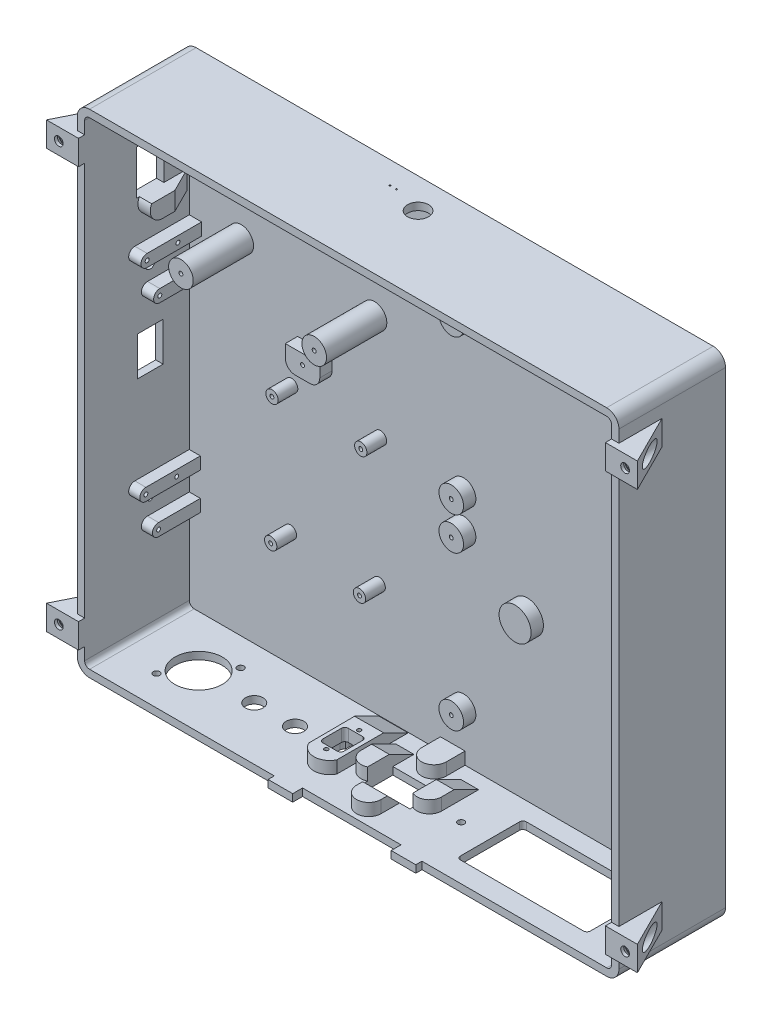
from build123d import *

# Parameters (mm, degrees)
SKETCH2_W                                      = 279.4
SKETCH2_H                                      = 254
BOSS_EXTRUDE1_DEPTH                            = 1
FILLET2_R                                      = 6.35
BOSS_EXTRUDE3_START                            = 57.15
BOSS_EXTRUDE3_DEPTH                            = 57.15
SKETCH7_W                                      = 50.8
SKETCH7_H                                      = 5.08
ROMEX_ENTRY_SLOT_DEPTH                         = 57.15
BOSS_EXTRUDE4_DEPTH                            = 12.7
SKETCH9_R                                      = 3.81
CUT_EXTRUDE2_DEPTH                             = 35.306
MIRROR3_COPY_1_DEPTH                           = 12.7
MIRROR3_COPY_2_SKETCH_R                        = 3.81
MIRROR3_COPY_2_DEPTH                           = 35.306
MIRROR4_COPY_1_DEPTH                           = 12.7
MIRROR4_COPY_2_SKETCH_R                        = 3.81
MIRROR4_COPY_2_DEPTH                           = 35.306
MIRROR4_COPY_4_DEPTH                           = 12.7
MIRROR4_COPY_5_SKETCH_R                        = 3.81
MIRROR4_COPY_5_DEPTH                           = 35.306
MIRROR4_COPY_7_DEPTH                           = 12.7
MIRROR4_COPY_8_SKETCH_R                        = 3.81
MIRROR4_COPY_8_DEPTH                           = 35.306
SKETCH15_W                                     = 12.7
SKETCH15_H                                     = 228.6
CUT_EXTRUDE4_DEPTH                             = 30.226
CUT_EXTRUDE8_REACH                             = 325.779
SKETCH24_R                                     = 2.5019
SKETCH24_R_2                                   = 1.318988248
SKETCH24_W                                     = 13.208
SKETCH24_H                                     = 20.066
SKETCH24_W_2                                   = 14.0462
SKETCH24_H_2                                   = 22.86
CUT_EXTRUDE10_REACH                            = 325.779
SKETCH30_R                                     = 1.27
RIGHT_SIDE_FRONT_STANDOFFS_DEPTH               = 6.35
RIGHT_SIDE_REAR_STANDOFFS_DEPTH                = 5.715
F_3_0_213_DIAMETER_HOLE1_D                     = 2.032
F_3_0_213_DIAMETER_HOLE1_DEPTH                 = 6.35
F_3_0_213_DIAMETER_HOLE1_TIP                   = 0.610474389
F_3_0_213_DIAMETER_HOLE2_D                     = 2.032
F_3_0_213_DIAMETER_HOLE2_DEPTH                 = 6.35
F_3_0_213_DIAMETER_HOLE2_TIP                   = 0.610474389
SKETCH39_R                                     = 8.255
SKETCH39_R_2                                   = 6.35
BOSS_EXTRUDE11_DEPTH                           = 6.35
STANDOFF_HOLES_D                               = 2.032
STANDOFF_HOLES_DEPTH                           = 6.35
STANDOFF_HOLES_TIP                             = 0.610474389
SKETCH49_R                                     = 3.175
MOTHERBOARD_STANDOFFS_DEPTH                    = 10.16
MOTHERBOARD_SCREW_HOLES_D                      = 2.032
MOTHERBOARD_SCREW_HOLES_DEPTH                  = 6.35
MOTHERBOARD_SCREW_HOLES_TIP                    = 0.610474389
BOSS_EXTRUDE13_DEPTH                           = 6.35
SKETCH58_R                                     = 4.572
SKETCH58_R_2                                   = 12.2428
SKETCH58_R_3                                   = 1.7
SKETCH58_R_4                                   = 1.651
CUT_EXTRUDE13_DEPTH                            = 3.81
CUT_EXTRUDE14_REACH                            = 303.866
SKETCH59_R                                     = 5.4356
SKETCH59_R_2                                   = 0.381
SKETCH60_R                                     = 6.35
BOSS_EXTRUDE15_DEPTH                           = 31.115
F_3_0_213_DIAMETER_HOLE6_D                     = 2.032
F_3_0_213_DIAMETER_HOLE6_DEPTH                 = 6.35
F_3_0_213_DIAMETER_HOLE6_TIP                   = 0.610474389
VENT_CUT_DEPTH                                 = 207.727314354
VENT_CUT_DEPTH_BACK                            = 3.175
SKETCH63_W                                     = 3.81
SKETCH63_H                                     = 203.2
USB_CUTOUT_REACH                               = 303.866
USB_STANDOFF_DEPTH                             = 6.35
USB_STANDOFF_SUPPORT_REACH                     = 237.887
SKETCH69_W                                     = 23.368
SKETCH69_H                                     = 14.5542
MOTHERBOARD_POWER_SWITCH_CUTOUT_DEPTH          = 3.81
USB_SCREW_HOLES_D                              = 2.032
USB_SCREW_HOLES_DEPTH                          = 6.35
USB_SCREW_HOLES_TIP                            = 0.610474389
MOTHERBOARD_POWER_SWITCH_STANDOFFS_DEPTH       = 6.35
MOTHERBOARD_POWER_SWITCH_STANDOFF_SUPPOR_DEPTH = 9.09955
MOTHERBOARD_POWER_SWITCH_STANDOFF_SU_2_DEPTH   = 9.09955
REAR_SCREW_HOLES_D                             = 2.794
REAR_SCREW_HOLES_DEPTH                         = 6.35
REAR_SCREW_HOLES_TIP                           = 0.839402285
BOSS_EXTRUDE16_DEPTH                           = 9.35355
BOSS_EXTRUDE17_DEPTH                           = 9.35355
LEFT_SIDE_PSU_SCREW_HOLES_D                    = 2.032
LEFT_SIDE_PSU_SCREW_HOLES_DEPTH                = 6.35
LEFT_SIDE_PSU_SCREW_HOLES_TIP                  = 0.610474389
SLIDE_COVER_STANDOFFS_DEPTH                    = 6.35
F_3_0_213_DIAMETER_HOLE7_D                     = 2.032
F_3_0_213_DIAMETER_HOLE7_DEPTH                 = 6.35
F_3_0_213_DIAMETER_HOLE7_TIP                   = 0.610474389
CUT_EXTRUDE15_DEPTH                            = 12.7
CUT_EXTRUDE16_DEPTH                            = 3.81


with BuildPart() as part:
    # Sketch2 → Boss-Extrude1 (new body)
    with BuildSketch(Plane.XY):
        Rectangle(SKETCH2_W, SKETCH2_H)
    extrude(amount=BOSS_EXTRUDE1_DEPTH)

    # Fillet2
    fillet2_edges = [part.edges().sort_by_distance(p)[0] for p in [
        (-139.7, 127, 0.5),
        (139.7, 127, 0.5),
        (139.7, -127, 0.5),
        (-139.7, -127, 0.5),
    ]]
    fillet(fillet2_edges, radius=FILLET2_R)

    # Sketch5 → Boss-Extrude3 (add)
    with BuildSketch(Plane.XY.offset(1).offset(BOSS_EXTRUDE3_START)):
        with BuildLine():
            Line((-133.35, -127), (133.35, -127))
            ThreePointArc((133.35, -127), (137.840128061, -125.140128061), (139.7, -120.65))
            Line((139.7, -120.65), (139.7, 120.65))
            ThreePointArc((139.7, 120.65), (137.840128061, 125.140128061), (133.35, 127))
            Line((133.35, 127), (-133.35, 127))
            ThreePointArc((-133.35, 127), (-137.840128061, 125.140128061), (-139.7, 120.65))
            Line((-139.7, 120.65), (-139.7, -120.65))
            ThreePointArc((-139.7, -120.65), (-137.840128061, -125.140128061), (-133.35, -127))
        make_face()
        with BuildLine():
            Line((-133.35, -123.19), (133.35, -123.19))
            ThreePointArc((133.35, -123.19), (135.146051224, -122.446051224), (135.89, -120.65))
            Line((135.89, -120.65), (135.89, 120.65))
            ThreePointArc((135.89, 120.65), (135.146051224, 122.446051224), (133.35, 123.19))
            Line((133.35, 123.19), (-133.35, 123.19))
            ThreePointArc((-133.35, 123.19), (-135.146051224, 122.446051224), (-135.89, 120.65))
            Line((-135.89, 120.65), (-135.89, -120.65))
            ThreePointArc((-135.89, -120.65), (-135.146051224, -122.446051224), (-133.35, -123.19))
        make_face(mode=Mode.SUBTRACT)
    extrude(amount=-BOSS_EXTRUDE3_DEPTH)

    # Sketch7 → Romex Entry Slot (cut)
    with BuildSketch(Plane(origin=(0, -123.19, 0), x_dir=(1, 0, 0), z_dir=(0, 1, 0))):
        with Locations((0, -55.61)):
            Rectangle(SKETCH7_W, SKETCH7_H)
    extrude(amount=-ROMEX_ENTRY_SLOT_DEPTH, mode=Mode.SUBTRACT)

    # Sketch8 → Boss-Extrude4 (add)
    with BuildSketch(Plane(origin=(0, 101.6, 0), x_dir=(1, 0, 0), z_dir=(0, 1, 0))):
        Polygon((-139.7, 0), (-152.4, 0), (-139.7, -25.4), align=None)
    boss_extrude4 = extrude(amount=BOSS_EXTRUDE4_DEPTH)

    # Sketch9 → Cut-Extrude2 (cut)
    with BuildSketch(Plane(origin=(0, 0, 3.81), x_dir=(-1, 0, 0), z_dir=(0, 0, -1))):
        with Locations((146.05, 107.95)):
            Circle(SKETCH9_R)
    cut_extrude2 = extrude(amount=-CUT_EXTRUDE2_DEPTH, mode=Mode.SUBTRACT)

    # Sketch13 → CSK for #8 Flat Head Machine Screw1 (revolve, cut)
    with BuildSketch(Plane(origin=(-146.05, 107.95, 3.81), x_dir=(0, -1, 0), z_dir=(1, 0, 0))):
        Polygon((0, 0), (0, 3.81), (2.2479, 3.81), (2.2479, 2.26450021), (4.2164, 0), align=None)
    csk_for_8_flat_head_machine_screw1 = revolve(axis=Axis((-146.05, 107.95, 10.16), (0, 0, -1)), mode=Mode.SUBTRACT)

    # Mirror2: Boss-Extrude4, Cut-Extrude2, CSK for #8 Flat Head Machine Screw1 across plane
    add(boss_extrude4.mirror(Plane.ZX))
    add(cut_extrude2.mirror(Plane.ZX), mode=Mode.SUBTRACT)
    add(csk_for_8_flat_head_machine_screw1.mirror(Plane.ZX), mode=Mode.SUBTRACT)

    # Mirror3: Boss-Extrude4, Cut-Extrude2, CSK for #8 Flat Head Machine Screw1 across plane
    add(boss_extrude4.mirror(Plane.ZY))
    add(cut_extrude2.mirror(Plane.ZY), mode=Mode.SUBTRACT)
    add(csk_for_8_flat_head_machine_screw1.mirror(Plane.ZY), mode=Mode.SUBTRACT)

    # Mirror3 copy 1 sketch → Mirror3 copy 1 (add)
    with BuildSketch(Plane(origin=(0, -101.6, 0), x_dir=(-1, 0, 0), z_dir=(0, -1, 0))):
        Polygon((-139.7, 0), (-152.4, 0), (-139.7, -25.4), align=None)
    extrude(amount=MIRROR3_COPY_1_DEPTH)

    # Mirror3 copy 2 sketch → Mirror3 copy 2 (cut)
    with BuildSketch(Plane(origin=(0, 0, 3.81), x_dir=(1, 0, 0), z_dir=(0, 0, -1))):
        with Locations((146.05, 107.95)):
            Circle(MIRROR3_COPY_2_SKETCH_R)
    extrude(amount=-MIRROR3_COPY_2_DEPTH, mode=Mode.SUBTRACT)

    # Mirror3 copy 3 sketch → Mirror3 copy 3 (revolve, cut)
    with BuildSketch(Plane(origin=(146.05, -107.95, 3.81), x_dir=(0, 1, 0), z_dir=(-1, 0, 0))):
        Polygon((0, 0), (0, 3.81), (2.2479, 3.81), (2.2479, 2.26450021), (4.2164, 0), align=None)
    revolve(axis=Axis((146.05, -107.95, 10.16), (0, 0, -1)), mode=Mode.SUBTRACT)

    # Mirror4: Boss-Extrude4, Cut-Extrude2, CSK for #8 Flat Head Machine Screw1 across plane
    add(boss_extrude4.mirror(Plane(origin=(0, 0, 29.075), x_dir=(1, 0, 0), z_dir=(0, 0, -1))))
    add(cut_extrude2.mirror(Plane(origin=(0, 0, 29.075), x_dir=(1, 0, 0), z_dir=(0, 0, -1))), mode=Mode.SUBTRACT)
    add(csk_for_8_flat_head_machine_screw1.mirror(Plane(origin=(0, 0, 29.075), x_dir=(1, 0, 0), z_dir=(0, 0, -1))), mode=Mode.SUBTRACT)

    # Mirror4 copy 1 sketch → Mirror4 copy 1 (add)
    with BuildSketch(Plane(origin=(0, -101.6, 58.15), x_dir=(1, 0, 0), z_dir=(0, -1, 0))):
        Polygon((-139.7, 0), (-152.4, 0), (-139.7, -25.4), align=None)
    extrude(amount=MIRROR4_COPY_1_DEPTH)

    # Mirror4 copy 2 sketch → Mirror4 copy 2 (cut)
    with BuildSketch(Plane(origin=(0, 0, 54.34), x_dir=(-1, 0, 0), z_dir=(0, 0, 1))):
        with Locations((146.05, 107.95)):
            Circle(MIRROR4_COPY_2_SKETCH_R)
    extrude(amount=-MIRROR4_COPY_2_DEPTH, mode=Mode.SUBTRACT)

    # Mirror4 copy 3 sketch → Mirror4 copy 3 (revolve, cut)
    with BuildSketch(Plane(origin=(-146.05, -107.95, 54.34), x_dir=(0, 1, 0), z_dir=(1, 0, 0))):
        Polygon((0, 0), (0, 3.81), (2.2479, 3.81), (2.2479, 2.26450021), (4.2164, 0), align=None)
    revolve(axis=Axis((-146.05, -107.95, 47.99), (0, 0, 1)), mode=Mode.SUBTRACT)

    # Mirror4 copy 4 sketch → Mirror4 copy 4 (add)
    with BuildSketch(Plane(origin=(0, 101.6, 58.15), x_dir=(-1, 0, 0), z_dir=(0, 1, 0))):
        Polygon((-139.7, 0), (-152.4, 0), (-139.7, -25.4), align=None)
    extrude(amount=MIRROR4_COPY_4_DEPTH)

    # Mirror4 copy 5 sketch → Mirror4 copy 5 (cut)
    with BuildSketch(Plane.XY.offset(54.34)):
        with Locations((146.05, 107.95)):
            Circle(MIRROR4_COPY_5_SKETCH_R)
    extrude(amount=-MIRROR4_COPY_5_DEPTH, mode=Mode.SUBTRACT)

    # Mirror4 copy 6 sketch → Mirror4 copy 6 (revolve, cut)
    with BuildSketch(Plane(origin=(146.05, 107.95, 54.34), x_dir=(0, -1, 0), z_dir=(-1, 0, 0))):
        Polygon((0, 0), (0, 3.81), (2.2479, 3.81), (2.2479, 2.26450021), (4.2164, 0), align=None)
    revolve(axis=Axis((146.05, 107.95, 47.99), (0, 0, 1)), mode=Mode.SUBTRACT)

    # Mirror4 copy 7 sketch → Mirror4 copy 7 (add)
    with BuildSketch(Plane(origin=(0, -101.6, 58.15), x_dir=(-1, 0, 0), z_dir=(0, -1, 0))):
        Polygon((-139.7, 0), (-152.4, 0), (-139.7, 25.4), align=None)
    extrude(amount=MIRROR4_COPY_7_DEPTH)

    # Mirror4 copy 8 sketch → Mirror4 copy 8 (cut)
    with BuildSketch(Plane.XY.offset(54.34)):
        with Locations((146.05, -107.95)):
            Circle(MIRROR4_COPY_8_SKETCH_R)
    extrude(amount=-MIRROR4_COPY_8_DEPTH, mode=Mode.SUBTRACT)

    # Mirror4 copy 9 sketch → Mirror4 copy 9 (revolve, cut)
    with BuildSketch(Plane(origin=(146.05, -107.95, 54.34), x_dir=(0, 1, 0), z_dir=(-1, 0, 0))):
        Polygon((0, 0), (0, -3.81), (2.2479, -3.81), (2.2479, -2.26450021), (4.2164, 0), align=None)
    revolve(axis=Axis((146.05, -107.95, 47.99), (0, 0, -1)), mode=Mode.SUBTRACT)

    # Sketch15 → Cut-Extrude4 (cut)
    with BuildSketch(Plane(origin=(0, 0, 0), x_dir=(-1, 0, 0), z_dir=(0, 0, -1))):
        with Locations((-146.05, 0)):
            Rectangle(SKETCH15_W, SKETCH15_H)
        with Locations((146.05, 0)):
            Rectangle(SKETCH15_W, SKETCH15_H)
    extrude(amount=-CUT_EXTRUDE4_DEPTH, mode=Mode.SUBTRACT)

    # Sketch24 → Cut-Extrude8 (cut, up to next)
    with BuildSketch(Plane.ZY.offset(139.7), mode=Mode.PRIVATE) as cut_extrude8_sk1:
        with Locations((21.1375, 39.941265276)):
            Circle(SKETCH24_R)
    cut_extrude8_tool1 = extrude(cut_extrude8_sk1.sketch, amount=-CUT_EXTRUDE8_REACH, mode=Mode.PRIVATE) & part.part
    # Sketch24 → Cut-Extrude8 (cut, up to next)
    with BuildSketch(Plane.ZY.offset(139.7), mode=Mode.PRIVATE) as cut_extrude8_sk2:
        with Locations((21.1375, 98.41033486)):
            Circle(SKETCH24_R_2)
    cut_extrude8_tool2 = extrude(cut_extrude8_sk2.sketch, amount=-CUT_EXTRUDE8_REACH, mode=Mode.PRIVATE) & part.part
    # Sketch24 → Cut-Extrude8 (cut, up to next)
    with BuildSketch(Plane.ZY.offset(139.7), mode=Mode.PRIVATE) as cut_extrude8_sk3:
        with Locations((21.1375, 69.54323486)):
            Circle(SKETCH24_R_2)
    cut_extrude8_tool3 = extrude(cut_extrude8_sk3.sketch, amount=-CUT_EXTRUDE8_REACH, mode=Mode.PRIVATE) & part.part
    # Sketch24 → Cut-Extrude8 (cut, up to next)
    with BuildSketch(Plane.ZY.offset(139.7), mode=Mode.PRIVATE) as cut_extrude8_sk4:
        with Locations((21.1375, 1.653505964)):
            Rectangle(SKETCH24_W, SKETCH24_H)
    cut_extrude8_tool4 = extrude(cut_extrude8_sk4.sketch, amount=-CUT_EXTRUDE8_REACH, mode=Mode.PRIVATE) & part.part
    # Sketch24 → Cut-Extrude8 (cut, up to next)
    with BuildSketch(Plane.ZY.offset(139.7), mode=Mode.PRIVATE) as cut_extrude8_sk5:
        with Locations((21.1375, 83.97678486)):
            Rectangle(SKETCH24_W_2, SKETCH24_H_2)
    cut_extrude8_tool5 = extrude(cut_extrude8_sk5.sketch, amount=-CUT_EXTRUDE8_REACH, mode=Mode.PRIVATE) & part.part
    add(cut_extrude8_tool1.solids().sort_by_distance((-139.7, 39.941265, 21.1375))[0], mode=Mode.SUBTRACT)
    add(cut_extrude8_tool2.solids().sort_by_distance((-139.7, 98.410335, 21.1375))[0], mode=Mode.SUBTRACT)
    add(cut_extrude8_tool3.solids().sort_by_distance((-139.7, 69.543235, 21.1375))[0], mode=Mode.SUBTRACT)
    add(cut_extrude8_tool4.solids().sort_by_distance((-139.7, 1.653506, 21.1375))[0], mode=Mode.SUBTRACT)
    add(cut_extrude8_tool5.solids().sort_by_distance((-139.7, 83.976785, 21.1375))[0], mode=Mode.SUBTRACT)

    # Sketch30 → Cut-Extrude10 (cut, up to next)
    with BuildSketch(Plane.ZY.offset(139.7), mode=Mode.PRIVATE) as cut_extrude10_sk1:
        with Locations((21.1375, -64.878547454)):
            Circle(SKETCH30_R)
    cut_extrude10_tool1 = extrude(cut_extrude10_sk1.sketch, amount=-CUT_EXTRUDE10_REACH, mode=Mode.PRIVATE) & part.part
    add(cut_extrude10_tool1.solids().sort_by_distance((-139.7, -64.878547, 21.1375))[0], mode=Mode.SUBTRACT)

    # Sketch27 → Right Side Front Standoffs (add)
    with BuildSketch(Plane(origin=(-135.89, 0, 0), x_dir=(0, 0, -1), z_dir=(1, 0, 0))):
        with BuildLine():
            Line((-29.0864608, 51.565215276), (-1, 51.565215276))
            Line((-1, 51.565215276), (-1, 45.215215276))
            Line((-1, 45.215215276), (-29.0864608, 45.215215276))
            ThreePointArc((-29.0864608, 45.215215276), (-32.2614608, 48.390215276), (-29.0864608, 51.565215276))
        make_face()
        with BuildLine():
            Line((-22.5523108, 32.585065276), (-1, 32.585065276))
            Line((-1, 32.585065276), (-1, 26.235065276))
            Line((-1, 26.235065276), (-22.5523108, 26.235065276))
            ThreePointArc((-22.5523108, 26.235065276), (-25.7273108, 29.410065276), (-22.5523108, 32.585065276))
        make_face()
        with BuildLine():
            Line((-14.7875, 104.76033486), (-14.7875, 95.40678486))
            Line((-14.7875, 95.40678486), (-26.73224641, 95.40678486))
            ThreePointArc((-26.73224641, 95.40678486), (-26.587043215, 101.669932803), (-21.1375, 104.76033486))
            Line((-21.1375, 104.76033486), (-14.7875, 104.76033486))
        make_face()
        with BuildLine():
            Line((-21.1375, 63.19323486), (-14.7875, 63.19323486))
            Line((-14.7875, 63.19323486), (-14.7875, 72.54678486))
            Line((-14.7875, 72.54678486), (-26.73224641, 72.54678486))
            ThreePointArc((-26.73224641, 72.54678486), (-26.587043215, 66.283636917), (-21.1375, 63.19323486))
        make_face()
    extrude(amount=RIGHT_SIDE_FRONT_STANDOFFS_DEPTH)

    # Sketch28 → Right Side Rear Standoffs (add)
    with BuildSketch(Plane(origin=(-135.89, 0, 0), x_dir=(0, 0, -1), z_dir=(1, 0, 0))):
        with BuildLine():
            Line((-29.0864608, -53.254597454), (-1, -53.254597454))
            Line((-1, -53.254597454), (-1, -59.604597454))
            Line((-1, -59.604597454), (-29.0864608, -59.604597454))
            ThreePointArc((-29.0864608, -59.604597454), (-32.2614608, -56.429597454), (-29.0864608, -53.254597454))
        make_face()
        with BuildLine():
            Line((-22.5523108, -72.234747454), (-1, -72.234747454))
            Line((-1, -72.234747454), (-1, -78.584747454))
            Line((-1, -78.584747454), (-22.5523108, -78.584747454))
            ThreePointArc((-22.5523108, -78.584747454), (-25.7273108, -75.409747454), (-22.5523108, -72.234747454))
        make_face()
    extrude(amount=RIGHT_SIDE_REAR_STANDOFFS_DEPTH)

    # #3 (0.213) Diameter Hole1
    with Locations(Plane(origin=(-129.54, 0, 0), x_dir=(0, 0, -1), z_dir=(1, 0, 0))):
        with Locations((-29.0864608, 48.390215276), (-13.18855, 48.390215276), (-22.5523108, 29.410065276)):
            Hole(F_3_0_213_DIAMETER_HOLE1_D / 2, depth=F_3_0_213_DIAMETER_HOLE1_DEPTH)
            with Locations((0, 0, -(F_3_0_213_DIAMETER_HOLE1_DEPTH + F_3_0_213_DIAMETER_HOLE1_TIP / 2))):  # 118° drill point
                Cone(0, F_3_0_213_DIAMETER_HOLE1_D / 2, F_3_0_213_DIAMETER_HOLE1_TIP, mode=Mode.SUBTRACT)

    # #3 (0.213) Diameter Hole2
    with Locations(Plane(origin=(-130.175, 0, 0), x_dir=(0, 0, -1), z_dir=(1, 0, 0))):
        with Locations((-29.0864608, -56.429597454), (-13.18855, -56.429597454), (-22.5523108, -75.409747454)):
            Hole(F_3_0_213_DIAMETER_HOLE2_D / 2, depth=F_3_0_213_DIAMETER_HOLE2_DEPTH)
            with Locations((0, 0, -(F_3_0_213_DIAMETER_HOLE2_DEPTH + F_3_0_213_DIAMETER_HOLE2_TIP / 2))):  # 118° drill point
                Cone(0, F_3_0_213_DIAMETER_HOLE2_D / 2, F_3_0_213_DIAMETER_HOLE2_TIP, mode=Mode.SUBTRACT)

    # Sketch39 → Boss-Extrude11 (add)
    with BuildSketch(Plane.XY.offset(1)):
        with Locations(Location((123.698, -40.639456059, 0), (0, 0, 180))):
            Circle(SKETCH39_R)
        with Locations(Location((38.5191, 112.116669853, 0), (0, 0, 180))):
            Circle(SKETCH39_R)
        with Locations(Location((5.583485881, -98.020620855, 0), (0, 0, 180))):
            Circle(SKETCH39_R_2)
        with Locations(Location((5.583485881, -18.645620855, 0), (0, 0, 180))):
            Circle(SKETCH39_R_2)
        with Locations(Location((5.583485881, -1.500620855, 0), (0, 0, 180))):
            Circle(SKETCH39_R_2)
        with Locations(Location((5.583485881, 77.874379145, 0), (0, 0, 180))):
            Circle(SKETCH39_R_2)
        with Locations(Location((38.5191, -40.639456059, 0), (0, 0, 180))):
            Circle(SKETCH39_R)
        with Locations(Location((123.698, 112.116669853, 0), (0, 0, 180))):
            Circle(SKETCH39_R)
        with BuildLine():
            Line((-80.013490438, 105.820173199), (-62.233490438, 105.820173199))
            Line((-62.233490438, 105.820173199), (-62.233490438, 114.418436715))
            ThreePointArc((-62.233490438, 114.418436715), (-63.72138799, 118.010539163), (-67.313490438, 119.498436715))
            Line((-67.313490438, 119.498436715), (-74.933490438, 119.498436715))
            ThreePointArc((-74.933490438, 119.498436715), (-78.525592887, 118.010539163), (-80.013490438, 114.418436715))
            Line((-80.013490438, 114.418436715), (-80.013490438, 105.820173199))
        make_face()
        with BuildLine():
            Line((-62.233490438, 25.175173199), (-80.013490438, 25.175173199))
            Line((-80.013490438, 25.175173199), (-80.013490438, 18.722402026))
            ThreePointArc((-80.013490438, 18.722402026), (-78.525592887, 15.130299577), (-74.933490438, 13.642402026))
            Line((-74.933490438, 13.642402026), (-67.313490438, 13.642402026))
            ThreePointArc((-67.313490438, 13.642402026), (-63.72138799, 15.130299577), (-62.233490438, 18.722402026))
            Line((-62.233490438, 18.722402026), (-62.233490438, 25.175173199))
        make_face()
    extrude(amount=BOSS_EXTRUDE11_DEPTH)

    # Standoff Holes
    with Locations(Plane.XY.offset(7.35)):
        with Locations((-71.123490438, 20.050115749), (-71.123490438, 113.090722992), (5.583485881, -98.020620855), (5.583485881, -18.645620855), (5.583485881, -1.500620855), (5.583485881, 77.874379145), (123.698, -40.639456059), (38.5191, 112.116669853)):
            Hole(STANDOFF_HOLES_D / 2, depth=STANDOFF_HOLES_DEPTH)
            with Locations((0, 0, -(STANDOFF_HOLES_DEPTH + STANDOFF_HOLES_TIP / 2))):  # 118° drill point
                Cone(0, STANDOFF_HOLES_D / 2, STANDOFF_HOLES_TIP, mode=Mode.SUBTRACT)

    # Sketch49 → Motherboard Standoffs (add)
    with BuildSketch(Plane.XY.offset(1)):
        with Locations(Location((-83.086839482, 1.79886482, 0), (0, 0, 180))):
            Circle(SKETCH49_R)
        with Locations(Location((-37.280139973, 1.339777633, 0), (0, 0, 180))):
            Circle(SKETCH49_R)
        with Locations(Location((-37.939662527, -64.465917493, 0), (0, 0, 180))):
            Circle(SKETCH49_R)
        with Locations(Location((-83.746362036, -64.006830306, 0), (0, 0, 180))):
            Circle(SKETCH49_R)
    extrude(amount=MOTHERBOARD_STANDOFFS_DEPTH)

    # Motherboard Screw Holes
    with Locations(Plane.XY.offset(11.16)):
        with Locations((-83.086839482, 1.79886482), (-37.280139973, 1.339777633), (-37.939662527, -64.465917493), (-83.746362036, -64.006830306)):
            Hole(MOTHERBOARD_SCREW_HOLES_D / 2, depth=MOTHERBOARD_SCREW_HOLES_DEPTH)
            with Locations((0, 0, -(MOTHERBOARD_SCREW_HOLES_DEPTH + MOTHERBOARD_SCREW_HOLES_TIP / 2))):  # 118° drill point
                Cone(0, MOTHERBOARD_SCREW_HOLES_D / 2, MOTHERBOARD_SCREW_HOLES_TIP, mode=Mode.SUBTRACT)

    # Sketch55 → Boss-Extrude13 (add)
    with BuildSketch(Plane.ZY.offset(-135.89)):
        with BuildLine():
            Line((36.66905, 118.947100483), (1, 118.947100483))
            Line((1, 118.947100483), (1, 106.247100483))
            Line((1, 106.247100483), (36.66905, 106.247100483))
            ThreePointArc((36.66905, 106.247100483), (43.01905, 112.597100483), (36.66905, 118.947100483))
        make_face()
        with BuildLine():
            Line((35.3165, -30.112799517), (1, -30.112799517))
            Line((1, -30.112799517), (1, -42.812799517))
            Line((1, -42.812799517), (35.3165, -42.812799517))
            ThreePointArc((35.3165, -42.812799517), (41.6665, -36.462799517), (35.3165, -30.112799517))
        make_face()
    extrude(amount=BOSS_EXTRUDE13_DEPTH)

    # Sketch58 → Cut-Extrude13 (cut)
    with BuildSketch(Plane.XZ.offset(127)):
        with Locations((-54.883181914, 27.4875)):
            Circle(SKETCH58_R)
        with Locations((-75.898929205, 27.4875)):
            Circle(SKETCH58_R)
        with Locations((-104.593225877, 27.4875)):
            Circle(SKETCH58_R_2)
        with Locations((-95.017425877, 15.3971)):
            Circle(SKETCH58_R_3)
        with Locations((-114.169025877, 39.5779)):
            Circle(SKETCH58_R_3)
        with Locations((127.606509889, 27.4875)):
            Circle(SKETCH58_R_4)
        with Locations((30.807109889, 27.4875)):
            Circle(SKETCH58_R_4)
    extrude(amount=-CUT_EXTRUDE13_DEPTH, mode=Mode.SUBTRACT)

    # Sketch59 → Cut-Extrude14 (cut, up to next)
    with BuildSketch(Plane(origin=(0, 127, 0), x_dir=(1, 0, 0), z_dir=(0, 1, 0)), mode=Mode.PRIVATE) as cut_extrude14_sk1:
        with Locations(Location((-3.291977324, -15.605, 0), (0, 0, 180))):
            Circle(SKETCH59_R)
    cut_extrude14_tool1 = extrude(cut_extrude14_sk1.sketch, amount=-CUT_EXTRUDE14_REACH, mode=Mode.PRIVATE) & part.part
    # Sketch59 → Cut-Extrude14 (cut, up to next)
    with BuildSketch(Plane(origin=(0, 127, 0), x_dir=(1, 0, 0), z_dir=(0, 1, 0)), mode=Mode.PRIVATE) as cut_extrude14_sk2:
        with Locations(Location((-21.773536951, -11.580675337, 0), (0, 0, 180))):
            Circle(SKETCH59_R_2)
    cut_extrude14_tool2 = extrude(cut_extrude14_sk2.sketch, amount=-CUT_EXTRUDE14_REACH, mode=Mode.PRIVATE) & part.part
    # Sketch59 → Cut-Extrude14 (cut, up to next)
    with BuildSketch(Plane(origin=(0, 127, 0), x_dir=(1, 0, 0), z_dir=(0, 1, 0)), mode=Mode.PRIVATE) as cut_extrude14_sk3:
        with Locations(Location((-18.471536951, -11.580675337, 0), (0, 0, 180))):
            Circle(SKETCH59_R_2)
    cut_extrude14_tool3 = extrude(cut_extrude14_sk3.sketch, amount=-CUT_EXTRUDE14_REACH, mode=Mode.PRIVATE) & part.part
    add(cut_extrude14_tool1.solids().sort_by_distance((-3.291977, 127, 15.605))[0], mode=Mode.SUBTRACT)
    add(cut_extrude14_tool2.solids().sort_by_distance((-21.773537, 127, 11.580675))[0], mode=Mode.SUBTRACT)
    add(cut_extrude14_tool3.solids().sort_by_distance((-18.471537, 127, 11.580675))[0], mode=Mode.SUBTRACT)

    # Sketch60 → Boss-Extrude15 (add)
    with BuildSketch(Plane.XY.offset(1)):
        with Locations(Location((-40.347044139, 54.24468354, 0), (0, 0, 180))):
            Circle(SKETCH60_R)
        with Locations(Location((-109.092144139, 54.24468354, 0), (0, 0, 180))):
            Circle(SKETCH60_R)
    extrude(amount=BOSS_EXTRUDE15_DEPTH)

    # #3 (0.213) Diameter Hole6
    with Locations(Plane.XY.offset(32.115)):
        with Locations((-40.347044139, 54.24468354), (-109.092144139, 54.24468354)):
            Hole(F_3_0_213_DIAMETER_HOLE6_D / 2, depth=F_3_0_213_DIAMETER_HOLE6_DEPTH)
            with Locations((0, 0, -(F_3_0_213_DIAMETER_HOLE6_DEPTH + F_3_0_213_DIAMETER_HOLE6_TIP / 2))):  # 118° drill point
                Cone(0, F_3_0_213_DIAMETER_HOLE6_D / 2, F_3_0_213_DIAMETER_HOLE6_TIP, mode=Mode.SUBTRACT)

    # Sketch63 → Vent Cut (cut, two sides: drawn at the far end of the back side and taken through both)
    with BuildSketch(Plane.XY.offset(58.15).offset(-VENT_CUT_DEPTH_BACK)):
        with BuildLine():
            ThreePointArc((133.35, -127), (137.840128061, -125.140128061), (139.7, -120.65))
            Line((139.7, -120.65), (139.7, -114.3))
            Line((139.7, -114.3), (135.89, -114.3))
            Line((135.89, -114.3), (135.89, -120.65))
            ThreePointArc((135.89, -120.65), (135.146051224, -122.446051224), (133.35, -123.19))
            Line((133.35, -123.19), (38.1, -123.19))
            Line((38.1, -123.19), (38.1, -127))
            Line((38.1, -127), (133.35, -127))
        make_face()
        with Locations((137.795, 0)):
            Rectangle(SKETCH63_W, SKETCH63_H)
        with BuildLine():
            Line((135.89, 120.65), (135.89, 114.3))
            Line((135.89, 114.3), (139.7, 114.3))
            Line((139.7, 114.3), (139.7, 120.65))
            ThreePointArc((139.7, 120.65), (137.840128061, 125.140128061), (133.35, 127))
            Line((133.35, 127), (-133.35, 127))
            ThreePointArc((-133.35, 127), (-137.840128061, 125.140128061), (-139.7, 120.65))
            Line((-139.7, 120.65), (-139.7, 114.3))
            Line((-139.7, 114.3), (-135.89, 114.3))
            Line((-135.89, 114.3), (-135.89, 120.65))
            ThreePointArc((-135.89, 120.65), (-135.146051224, 122.446051224), (-133.35, 123.19))
            Line((-133.35, 123.19), (133.35, 123.19))
            ThreePointArc((133.35, 123.19), (135.146051224, 122.446051224), (135.89, 120.65))
        make_face()
        with Locations((-137.795, 0)):
            Rectangle(SKETCH63_W, SKETCH63_H)
        with BuildLine():
            Line((-135.89, -120.65), (-135.89, -114.3))
            Line((-135.89, -114.3), (-139.7, -114.3))
            Line((-139.7, -114.3), (-139.7, -120.65))
            ThreePointArc((-139.7, -120.65), (-137.840128061, -125.140128061), (-133.35, -127))
            Line((-133.35, -127), (-38.1, -127))
            Line((-38.1, -127), (-38.1, -123.19))
            Line((-38.1, -123.19), (-133.35, -123.19))
            ThreePointArc((-133.35, -123.19), (-135.146051224, -122.446051224), (-135.89, -120.65))
        make_face()
    extrude(amount=VENT_CUT_DEPTH + VENT_CUT_DEPTH_BACK, mode=Mode.SUBTRACT)

    # Sketch64 → USB Cutout (cut, up to next)
    with BuildSketch(Plane.XZ.offset(127), mode=Mode.PRIVATE) as usb_cutout_sk1:
        with BuildLine():
            Line((-35.546238772, 35.95205), (-35.546238772, 34.217383312))
            ThreePointArc((-35.546238772, 34.217383312), (-36.234491269, 33.338798191), (-36.479688772, 32.25))
            Line((-36.479688772, 32.25), (-36.479688772, 22.725))
            ThreePointArc((-36.479688772, 22.725), (-36.234491269, 21.636201809), (-35.546238772, 20.757616688))
            Line((-35.546238772, 20.757616688), (-35.546238772, 19.02295))
            ThreePointArc((-35.546238772, 19.02295), (-30.263038772, 13.73975), (-24.979838772, 19.02295))
            Line((-24.979838772, 19.02295), (-24.979838772, 20.757616688))
            ThreePointArc((-24.979838772, 20.757616688), (-24.291586276, 21.636201809), (-24.046388772, 22.725))
            Line((-24.046388772, 22.725), (-24.046388772, 32.25))
            ThreePointArc((-24.046388772, 32.25), (-24.291586276, 33.338798191), (-24.979838772, 34.217383312))
            Line((-24.979838772, 34.217383312), (-24.979838772, 35.95205))
            ThreePointArc((-24.979838772, 35.95205), (-30.263038772, 41.23525), (-35.546238772, 35.95205))
        make_face()
    usb_cutout_tool1 = extrude(usb_cutout_sk1.sketch, amount=-USB_CUTOUT_REACH, mode=Mode.PRIVATE) & part.part
    add(usb_cutout_tool1.solids().sort_by_distance((-30.263039, -127, 27.4875))[0], mode=Mode.SUBTRACT)

    # Sketch68 → USB Standoff (add)
    with BuildSketch(Plane(origin=(0, -123.19, 0), x_dir=(1, 0, 0), z_dir=(0, 1, 0))):
        with BuildLine():
            Line((-22.776388772, -1.254), (-22.776388772, -37.992104132))
            ThreePointArc((-22.776388772, -37.992104132), (-30.263038772, -42.50525), (-37.526024643, -37.640329641))
            Line((-37.526024643, -37.640329641), (-37.749688772, -1.254))
            Line((-37.749688772, -1.254), (-22.776388772, -1.254))
        make_face()
        with BuildLine():
            Line((-35.717688772, -22.725), (-35.717688772, -32.25))
            ThreePointArc((-35.717688772, -32.25), (-35.196924629, -33.507235857), (-33.939688772, -34.028))
            Line((-33.939688772, -34.028), (-26.586388772, -34.028))
            ThreePointArc((-26.586388772, -34.028), (-25.329152916, -33.507235857), (-24.808388772, -32.25))
            Line((-24.808388772, -32.25), (-24.808388772, -22.725))
            ThreePointArc((-24.808388772, -22.725), (-25.329152916, -21.467764143), (-26.586388772, -20.947))
            Line((-26.586388772, -20.947), (-33.939688772, -20.947))
            ThreePointArc((-33.939688772, -20.947), (-35.196924629, -21.467764143), (-35.717688772, -22.725))
        make_face(mode=Mode.SUBTRACT)
    extrude(amount=USB_STANDOFF_DEPTH)

    # USB Standoff support: up to this plane
    usb_standoff_support_end = Plane(origin=(-22.776388772, -116.84, 1.254), z_dir=(-1, 0, 0))
    # Sketch98 → USB Standoff support (cut, up to the surface)
    with BuildSketch(Plane(origin=(-37.755970421, 0, 0.232083212), x_dir=(0.006146811354838226, 0, 0.9999811081766335), z_dir=(-0.9999811081766335, 0, 0.006146811354838226)), mode=Mode.PRIVATE) as usb_standoff_support_sk1:
        Polygon((13.721936094, -116.84), (1.021936094, -123.19), (1.021936094, -116.84), align=None)
    usb_standoff_support_tool1 = split(extrude(usb_standoff_support_sk1.sketch, amount=-USB_STANDOFF_SUPPORT_REACH, mode=Mode.PRIVATE), bisect_by=usb_standoff_support_end, keep=Keep.BOTH, mode=Mode.PRIVATE)
    add(usb_standoff_support_tool1.solids().sort_by_distance((-37.723667, -118.956667, 5.487253))[0], mode=Mode.SUBTRACT)

    # Sketch69 → Motherboard Power Switch Cutout (cut)
    with BuildSketch(Plane.XZ.offset(127)):
        with Locations((0, 27.4875)):
            Rectangle(SKETCH69_W, SKETCH69_H)
    extrude(amount=-MOTHERBOARD_POWER_SWITCH_CUTOUT_DEPTH, mode=Mode.SUBTRACT)

    # USB Screw Holes
    with Locations(Plane(origin=(0, -123.19, 0), x_dir=(-1, 0, 0), z_dir=(0, -1, 0))):
        with Locations((30.263038772, -35.95205), (30.263038772, -19.02295)):
            Hole(USB_SCREW_HOLES_D / 2, depth=USB_SCREW_HOLES_DEPTH)
            with Locations((0, 0, -(USB_SCREW_HOLES_DEPTH + USB_SCREW_HOLES_TIP / 2))):  # 118° drill point
                Cone(0, USB_SCREW_HOLES_D / 2, USB_SCREW_HOLES_TIP, mode=Mode.SUBTRACT)

    # Sketch74 → Motherboard Power Switch Standoffs (add)
    with BuildSketch(Plane(origin=(0, -123.19, 0), x_dir=(1, 0, 0), z_dir=(0, 1, 0))):
        with BuildLine():
            Line((20.78355, -27.4875), (20.78355, -21.1375))
            Line((20.78355, -21.1375), (11.684, -21.1375))
            Line((11.684, -21.1375), (11.684, -33.211351395))
            ThreePointArc((11.684, -33.211351395), (17.814589596, -32.862541511), (20.78355, -27.4875))
        make_face()
        with BuildLine():
            Line((-11.684, -22.040219874), (-11.684, -33.211351395))
            ThreePointArc((-11.684, -33.211351395), (-17.814589596, -32.862541511), (-20.78355, -27.4875))
            Line((-20.78355, -27.4875), (-20.78355, -22.040219874))
            Line((-20.78355, -22.040219874), (-11.684, -22.040219874))
        make_face()
    extrude(amount=MOTHERBOARD_POWER_SWITCH_STANDOFFS_DEPTH)

    # Sketch79 → Motherboard Power Switch Standoff Suppor (add)
    with BuildSketch(Plane.ZY.offset(20.78355)):
        Polygon((22.040219874, -116.84), (22.040219874, -123.19), (9.340219874, -123.19), align=None)
    extrude(amount=-MOTHERBOARD_POWER_SWITCH_STANDOFF_SUPPOR_DEPTH)

    # Sketch80 → Motherboard Power Switch Standoff Su 2 (add)
    with BuildSketch(Plane(origin=(20.78355, 0, 0), x_dir=(0, 0, -1), z_dir=(1, 0, 0))):
        Polygon((-21.1375, -116.84), (-21.1375, -123.19), (-8.4375, -123.19), align=None)
    extrude(amount=-MOTHERBOARD_POWER_SWITCH_STANDOFF_SU_2_DEPTH)

    # Rear Screw Holes
    with Locations(Plane(origin=(0, -127, 0), x_dir=(-1, 0, 0), z_dir=(0, -1, 0))):
        with Locations((14.43355, -27.4875), (-14.43355, -27.4875)):
            Hole(REAR_SCREW_HOLES_D / 2, depth=REAR_SCREW_HOLES_DEPTH)
            with Locations((0, 0, -(REAR_SCREW_HOLES_DEPTH + REAR_SCREW_HOLES_TIP / 2))):  # 118° drill point
                Cone(0, REAR_SCREW_HOLES_D / 2, REAR_SCREW_HOLES_TIP, mode=Mode.SUBTRACT)

    # Sketch83 → Boss-Extrude16 (add)
    with BuildSketch(Plane(origin=(0, 104.76033486, 0), x_dir=(1, 0, 0), z_dir=(0, 1, 0))):
        Polygon((-129.54, -14.7875), (-135.89, -14.7875), (-135.89, -2.0875), align=None)
    extrude(amount=-BOSS_EXTRUDE16_DEPTH)

    # Sketch85 → Boss-Extrude17 (add)
    with BuildSketch(Plane.XZ.offset(-63.19323486)):
        Polygon((-129.54, 14.7875), (-135.89, 14.7875), (-135.89, 2.0875), align=None)
    extrude(amount=-BOSS_EXTRUDE17_DEPTH)

    # Left Side PSU Screw Holes
    with Locations(Plane.ZY.offset(-129.54)):
        with Locations((36.66905, 112.533600483), (35.3165, -36.462799517)):
            Hole(LEFT_SIDE_PSU_SCREW_HOLES_D / 2, depth=LEFT_SIDE_PSU_SCREW_HOLES_DEPTH)
            with Locations((0, 0, -(LEFT_SIDE_PSU_SCREW_HOLES_DEPTH + LEFT_SIDE_PSU_SCREW_HOLES_TIP / 2))):  # 118° drill point
                Cone(0, LEFT_SIDE_PSU_SCREW_HOLES_D / 2, LEFT_SIDE_PSU_SCREW_HOLES_TIP, mode=Mode.SUBTRACT)

    # Sketch92 → Slide Cover Standoffs (add)
    with BuildSketch(Plane(origin=(0, -123.19, 0), x_dir=(1, 0, 0), z_dir=(0, 1, 0))):
        with BuildLine():
            Line((6.35, -10.6854), (6.35, -1))
            Line((6.35, -1), (-6.35, -1))
            Line((-6.35, -1), (-6.35, -10.6854))
            ThreePointArc((-6.35, -10.6854), (0, -17.0354), (6.35, -10.6854))
        make_face()
        with BuildLine():
            Line((6.35, -44.2896), (6.35, -34.7646))
            Line((6.35, -34.7646), (-6.35, -34.7646))
            Line((-6.35, -34.7646), (-6.35, -44.2896))
            ThreePointArc((-6.35, -44.2896), (0, -50.6396), (6.35, -44.2896))
        make_face()
    extrude(amount=SLIDE_COVER_STANDOFFS_DEPTH)

    # #3 (0.213) Diameter Hole7
    with Locations(Plane(origin=(0, -127, 0), x_dir=(-1, 0, 0), z_dir=(0, -1, 0))):
        with Locations((0, -44.2896), (0, -10.6854)):
            Hole(F_3_0_213_DIAMETER_HOLE7_D / 2, depth=F_3_0_213_DIAMETER_HOLE7_DEPTH)
            with Locations((0, 0, -(F_3_0_213_DIAMETER_HOLE7_DEPTH + F_3_0_213_DIAMETER_HOLE7_TIP / 2))):  # 118° drill point
                Cone(0, F_3_0_213_DIAMETER_HOLE7_D / 2, F_3_0_213_DIAMETER_HOLE7_TIP, mode=Mode.SUBTRACT)

    # Sketch99 → Cut-Extrude15 (cut)
    with BuildSketch(Plane.ZY.offset(6.35)):
        Polygon((34.7646, -123.19), (41.1146, -116.84), (34.7646, -116.84), align=None)
    extrude(amount=-CUT_EXTRUDE15_DEPTH, mode=Mode.SUBTRACT)

    # Sketch101 → Cut-Extrude16 (cut)
    with BuildSketch(Plane.XZ.offset(127)):
        with BuildLine():
            Line((110.956809889, 44.5055), (47.456809889, 44.5055))
            ThreePointArc((47.456809889, 44.5055), (46.199574032, 43.984735857), (45.678809889, 42.7275))
            Line((45.678809889, 42.7275), (45.678809889, 12.2475))
            ThreePointArc((45.678809889, 12.2475), (46.199574032, 10.990264143), (47.456809889, 10.4695))
            Line((47.456809889, 10.4695), (110.956809889, 10.4695))
            ThreePointArc((110.956809889, 10.4695), (112.214045746, 10.990264143), (112.734809889, 12.2475))
            Line((112.734809889, 12.2475), (112.734809889, 42.7275))
            ThreePointArc((112.734809889, 42.7275), (112.214045746, 43.984735857), (110.956809889, 44.5055))
        make_face()
    extrude(amount=-CUT_EXTRUDE16_DEPTH, mode=Mode.SUBTRACT)


solid = part.part
